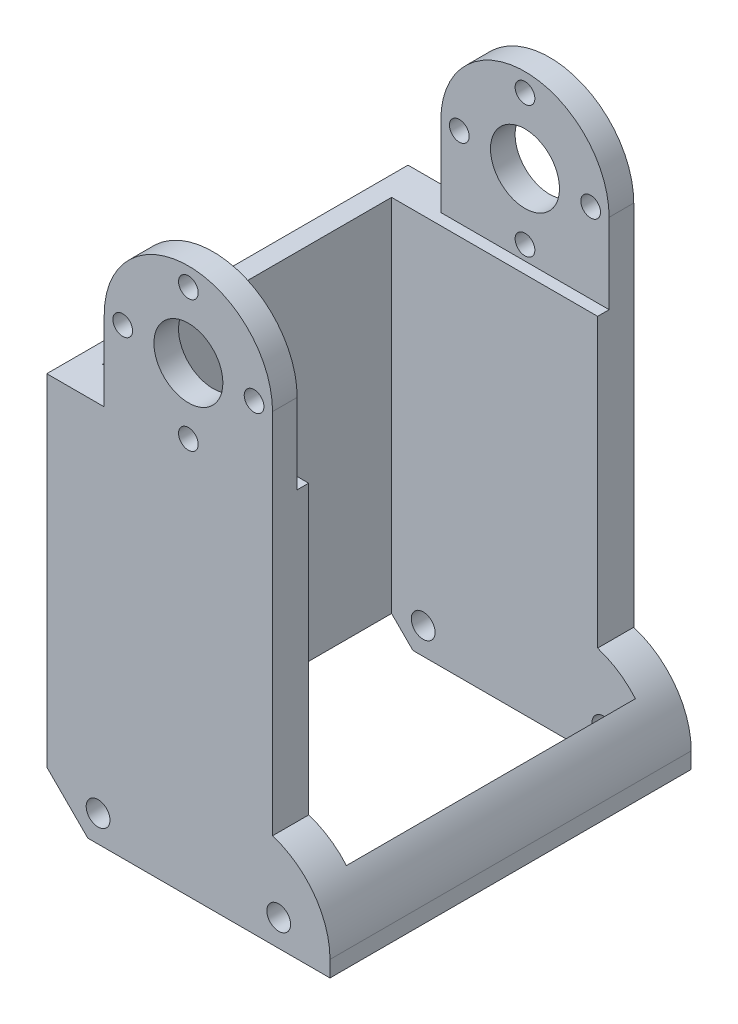
from build123d import *

# Parameters (mm, degrees)
BOSS_EXTRUDE1_DEPTH      = 22
BOSS_EXTRUDE1_DEPTH_BACK = 22
SKETCH2_W                = 38
SKETCH2_H                = 20
CUT_EXTRUDE1_DEPTH       = 105.423416914
SKETCH3_W                = 7
SKETCH3_H                = 44
BOSS_EXTRUDE2_DEPTH      = 65.5
SKETCH23_R               = 5
SKETCH23_R_2             = 1.2
CUT_EXTRUDE2_DEPTH       = 111.605436123
SKETCH24_W               = 28.5
SKETCH24_H               = 34
CUT_EXTRUDE3_DEPTH       = 90.954502389
SKETCH26_R               = 1.2
SKETCH26_R_2             = 5
SKETCH26_R_3             = 1.45
CUT_EXTRUDE6_DEPTH       = 107.330263801
SKETCH27_W               = 29.7
SKETCH27_H               = 35.2
CUT_EXTRUDE8_DEPTH       = 73.137455597
SKETCH29_W               = 7
SKETCH29_H               = 35
CUT_EXTRUDE10_DEPTH      = 74.468530678
CHAMFER2_SIZE            = 5
FILLET1_START            = -23
FILLET1_DEPTH            = 46


with BuildPart() as part:
    # Sketch1 → Boss-Extrude1 (new, two sides: drawn at the far end of the back side and taken through both)
    with BuildSketch(Plane.XY.offset(-BOSS_EXTRUDE1_DEPTH_BACK)):
        with BuildLine():
            Line((10.25, -60), (10.25, 0))
            ThreePointArc((10.25, 0), (0, -10.25), (-10.25, 0))
            Line((-10.25, 0), (-10.25, -60))
            Line((-10.25, -60), (-10.25, -100))
            Line((-10.25, -100), (10.25, -100))
            Line((10.25, -100), (10.25, -60))
        make_face()
        with BuildLine():
            Line((10.25, 0), (9.2, 0))
            ThreePointArc((9.2, 0), (8.816088231, -0.879772698), (7.91, -1.196620241))
            ThreePointArc((7.91, -1.196620241), (5.656854249, -5.656854249), (1.196620241, -7.91))
            ThreePointArc((1.196620241, -7.91), (1.199154762, -7.954968281), (1.2, -8))
            ThreePointArc((1.2, -8), (-0.045031719, -9.199154762), (-1.196620241, -7.91))
            ThreePointArc((-1.196620241, -7.91), (-5.656854249, -5.656854249), (-7.91, -1.196620241))
            ThreePointArc((-7.91, -1.196620241), (-8.816088231, -0.879772698), (-9.2, 0))
            Line((-9.2, 0), (-10.25, 0))
            ThreePointArc((-10.25, 0), (0, -10.25), (10.25, 0))
        make_face()
        with BuildLine():
            ThreePointArc((7.91, -1.196620241), (7.120227302, -0.816088231), (6.8, 0))
            Line((6.8, 0), (4.2, 0))
            ThreePointArc((4.2, 0), (0, -4.2), (-4.2, 0))
            Line((-4.2, 0), (-6.8, 0))
            ThreePointArc((-6.8, 0), (-7.120227302, -0.816088231), (-7.91, -1.196620241))
            ThreePointArc((-7.91, -1.196620241), (-5.656854249, -5.656854249), (-1.196620241, -7.91))
            ThreePointArc((-1.196620241, -7.91), (0, -6.8), (1.196620241, -7.91))
            ThreePointArc((1.196620241, -7.91), (5.656854249, -5.656854249), (7.91, -1.196620241))
        make_face()
        with BuildLine():
            Line((4.2, 0), (6.8, 0))
            ThreePointArc((6.8, 0), (7.120227302, 0.816088231), (7.91, 1.196620241))
            ThreePointArc((7.91, 1.196620241), (5.656854249, 5.656854249), (1.196620241, 7.91))
            ThreePointArc((1.196620241, 7.91), (0, 6.8), (-1.196620241, 7.91))
            ThreePointArc((-1.196620241, 7.91), (-5.656854249, 5.656854249), (-7.91, 1.196620241))
            ThreePointArc((-7.91, 1.196620241), (-7.120227302, 0.816088231), (-6.8, 0))
            Line((-6.8, 0), (-4.2, 0))
            ThreePointArc((-4.2, 0), (0, 4.2), (4.2, 0))
        make_face()
        with BuildLine():
            ThreePointArc((7.91, 1.196620241), (8.816088231, 0.879772698), (9.2, 0))
            Line((9.2, 0), (10.25, 0))
            ThreePointArc((10.25, 0), (0, 10.25), (-10.25, 0))
            Line((-10.25, 0), (-9.2, 0))
            ThreePointArc((-9.2, 0), (-8.816088231, 0.879772698), (-7.91, 1.196620241))
            ThreePointArc((-7.91, 1.196620241), (-5.656854249, 5.656854249), (-1.196620241, 7.91))
            ThreePointArc((-1.196620241, 7.91), (-0.045031719, 9.199154762), (1.2, 8))
            ThreePointArc((1.2, 8), (1.199154762, 7.954968281), (1.196620241, 7.91))
            ThreePointArc((1.196620241, 7.91), (5.656854249, 5.656854249), (7.91, 1.196620241))
        make_face()
    extrude(amount=BOSS_EXTRUDE1_DEPTH + BOSS_EXTRUDE1_DEPTH_BACK)

    # Sketch2 → Cut-Extrude1 (cut, through all)
    with BuildSketch(Plane.ZY.offset(10.25)):
        with Locations((0, 0.25)):
            Rectangle(SKETCH2_W, SKETCH2_H)
    extrude(amount=-CUT_EXTRUDE1_DEPTH, mode=Mode.SUBTRACT)

    # Sketch3 → Boss-Extrude2 (add)
    with BuildSketch(Plane(origin=(0, -9.75, 0), x_dir=(1, 0, 0), z_dir=(0, 1, 0))):
        with Locations((-13.75, 0)):
            Rectangle(SKETCH3_W, SKETCH3_H)
        with Locations((13.75, 0)):
            Rectangle(SKETCH3_W, SKETCH3_H)
    extrude(amount=-BOSS_EXTRUDE2_DEPTH)

    # Sketch23 → Cut-Extrude2 (cut, through all)
    with BuildSketch(Plane.XY.offset(22)):
        with BuildLine():
            Line((-10.25, -100), (10.25, -100))
            Line((10.25, -100), (10.25, -85))
            ThreePointArc((10.25, -85), (0, -95.25), (-10.25, -85))
            Line((-10.25, -85), (-10.25, -100))
        make_face()
        with Locations((0, -85)):
            Circle(SKETCH23_R)
        with Locations((8, -85)):
            Circle(SKETCH23_R_2)
        with Locations((0, -77)):
            Circle(SKETCH23_R_2)
        with Locations((0, -93)):
            Circle(SKETCH23_R_2)
        with Locations((-8, -85)):
            Circle(SKETCH23_R_2)
    extrude(amount=-CUT_EXTRUDE2_DEPTH, mode=Mode.SUBTRACT)

    # Sketch24 → Cut-Extrude3 (cut, through all)
    with BuildSketch(Plane(origin=(0, -9.75, 0), x_dir=(1, 0, 0), z_dir=(0, 1, 0))):
        Rectangle(SKETCH24_W, SKETCH24_H)
    extrude(amount=-CUT_EXTRUDE3_DEPTH, mode=Mode.SUBTRACT)

    # Sketch26 → Cut-Extrude6 (cut, through all)
    # profile 1 of 5: a face of its own
    with BuildSketch(Plane.XY.offset(22)):
        with BuildLine():
            Line((10.25, -75.25), (14.25, -75.25))
            Line((14.25, -75.25), (14.25, -56.53282359))
            Line((14.25, -56.53282359), (14.25, -56.25))
            Line((14.25, -56.25), (-14.25, -56.25))
            Line((-14.25, -56.25), (-14.25, -56.53282359))
            Line((-14.25, -56.53282359), (-14.25, -75.25))
            Line((-14.25, -75.25), (-10.25, -75.25))
            Line((-10.25, -75.25), (-10.25, -85))
            ThreePointArc((-10.25, -85), (0, -95.25), (10.25, -85))
            Line((10.25, -85), (10.25, -75.25))
        make_face()
        with Locations((-8, -85)):
            Circle(SKETCH26_R, mode=Mode.SUBTRACT)
        with Locations((0, -85)):
            Circle(SKETCH26_R_2, mode=Mode.SUBTRACT)
        with Locations((0, -77)):
            Circle(SKETCH26_R, mode=Mode.SUBTRACT)
        with Locations((0, -93)):
            Circle(SKETCH26_R, mode=Mode.SUBTRACT)
        with Locations((8, -85)):
            Circle(SKETCH26_R, mode=Mode.SUBTRACT)
    # profile 2 of 5: a face of its own
    with BuildSketch(Plane.XY.offset(22)):
        Polygon((-17.25, -75.25), (-14.25, -75.25), (-14.25, -56.53282359), (-14.25, -56.25), (-17.25, -56.25), align=None)
    # profile 3 of 5: a face of its own
    with BuildSketch(Plane.XY.offset(22)):
        Polygon((14.25, -56.53282359), (14.25, -75.25), (17.25, -75.25), (17.25, -56.25), (14.25, -56.25), align=None)
    # profile 4 of 5: a face of its own
    with BuildSketch(Plane.XY.offset(22)):
        with Locations((-11, -53)):
            Circle(SKETCH26_R_3)
    # profile 5 of 5: a face of its own
    with BuildSketch(Plane.XY.offset(22)):
        with Locations((11, -53)):
            Circle(SKETCH26_R_3)
    extrude(amount=-CUT_EXTRUDE6_DEPTH, mode=Mode.SUBTRACT)

    # Sketch27 → Cut-Extrude8 (cut, through all)
    with BuildSketch(Plane.XZ.offset(56.25)):
        Rectangle(SKETCH27_W, SKETCH27_H)
    extrude(amount=-CUT_EXTRUDE8_DEPTH, mode=Mode.SUBTRACT)

    # Sketch29 → Cut-Extrude10 (cut, through all)
    with BuildSketch(Plane(origin=(0, 0, -22), x_dir=(-1, 0, 0), z_dir=(0, 0, -1))):
        with Locations((-13.75, -27.25)):
            Rectangle(SKETCH29_W, SKETCH29_H)
    extrude(amount=-CUT_EXTRUDE10_DEPTH, mode=Mode.SUBTRACT)

    # Chamfer2
    # the kernel refuses this chamfer: 5 mm, written as the material it takes off along each edge
    with BuildSketch(Plane(origin=(-17.25, -56.25, 34.85841494), x_dir=(1, 0, 0), z_dir=(0, 0, -1))) as chamfer2_piece_1:
        Polygon((CHAMFER2_SIZE, 0), (0, -CHAMFER2_SIZE), (0, 0), align=None)
    extrude(amount=69.71682988, mode=Mode.SUBTRACT)

    # Fillet1: read off the stored shape, not the designer's step
    # Fillet1 outline → Fillet1 (cut)
    with BuildSketch(Plane.XY.offset(FILLET1_START)):
        with BuildLine():
            ThreePointArc((10.25, -44.75), (15.312257748, -48.373312231), (17.25, -54.289392014))
            Line((17.25, -54.289392014), (17.25, -44.75))
            Line((17.25, -44.75), (10.25, -44.75))
        make_face()
    extrude(amount=FILLET1_DEPTH, mode=Mode.SUBTRACT)


solid = part.part
